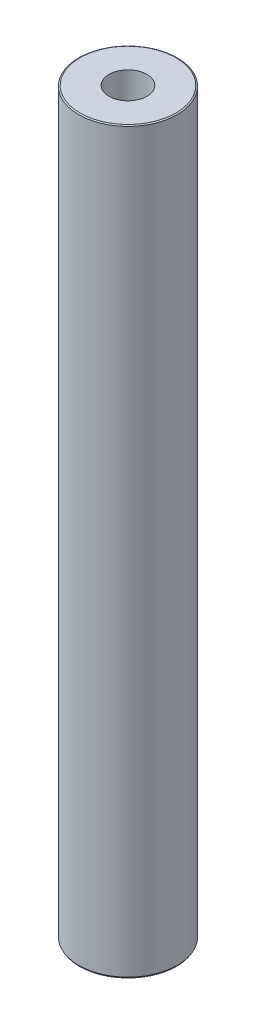
from build123d import *
from OCP.BRepFilletAPI import BRepFilletAPI_MakeChamfer

# Parameters (mm, degrees)
SKETCH1_R           = 40
BOSS_EXTRUDE1_DEPTH = 600
SKETCH2_R           = 15.41676725
CUT_EXTRUDE1_DEPTH  = 603.660766933
CHAMFER1_SIZE       = 0.603724282
CHAMFER1_SIZE2      = 1.04568113


with BuildPart() as part:
    # Sketch1 → Boss-Extrude1 (new body)
    with BuildSketch(Plane(origin=(0, 0, 0), x_dir=(1, 0, 0), z_dir=(0, 1, 0))):
        Circle(SKETCH1_R)
    extrude(amount=BOSS_EXTRUDE1_DEPTH)

    # Sketch2 → Cut-Extrude1 (cut, through all)
    with BuildSketch(Plane(origin=(0, 0, 0), x_dir=(1, 0, 0), z_dir=(0, 1, 0))):
        Circle(SKETCH2_R)
    extrude(amount=CUT_EXTRUDE1_DEPTH, mode=Mode.SUBTRACT)

    # Chamfer1: one chamfer whose edges measure the first distance from different faces: ONE call of the kernel's chamfer builder (chamfer() names one face for all edges)
    chamfer1_edges_1 = [part.edges().sort_by_distance(p)[0] for p in [
        (-40, 600, 0),
    ]]
    chamfer1_side_1 = [part.faces().sort_by_distance(p)[0] for p in [
        (-40, 300, 0),
    ]]
    chamfer1_edges_2 = [part.edges().sort_by_distance(p)[0] for p in [
        (-40, 0, 0),
    ]]
    chamfer1_side_2 = [part.faces().sort_by_distance(p)[0] for p in [
        (-38.86862915, 0, 0),
    ]]
    chamfer1 = BRepFilletAPI_MakeChamfer(part.part.solid().wrapped)
    for e in chamfer1_edges_1:
        chamfer1.Add(CHAMFER1_SIZE, CHAMFER1_SIZE2, e.wrapped, chamfer1_side_1[0].wrapped)  # the first distance lies on this face
    for e in chamfer1_edges_2:
        chamfer1.Add(CHAMFER1_SIZE, CHAMFER1_SIZE2, e.wrapped, chamfer1_side_2[0].wrapped)  # the first distance lies on this face
    add(Compound.cast(chamfer1.Shape()), mode=Mode.REPLACE)


solid = part.part
